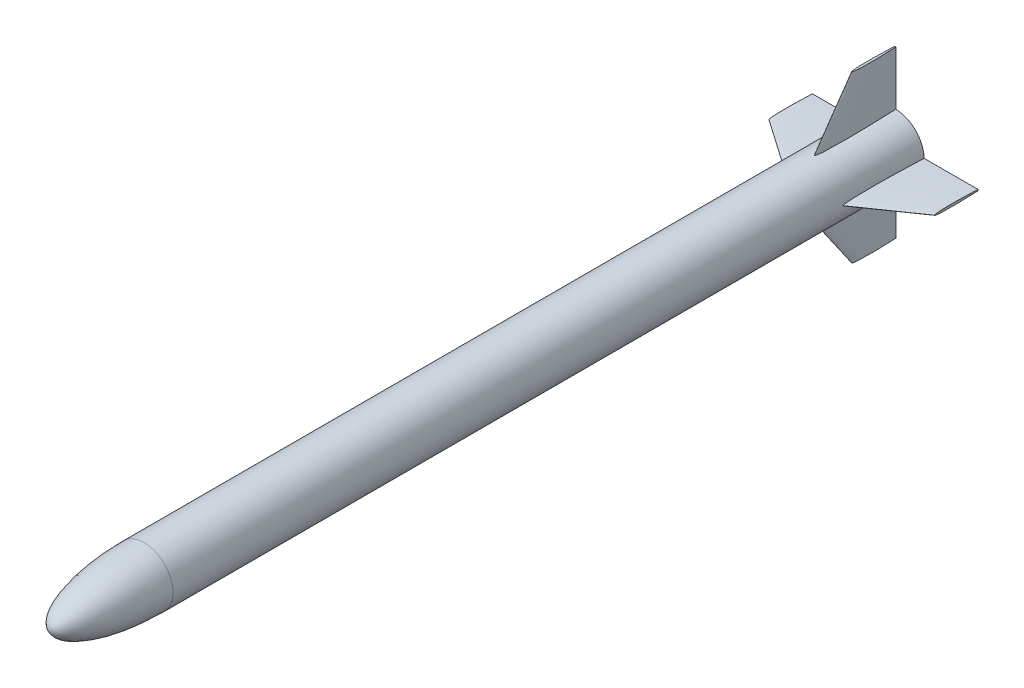
from build123d import *

# Parameters (mm, degrees)
SKETCH3_R                = 43.942
BOSS_EXTRUDE1_DEPTH      = 15.24
BOSS_EXTRUDE2_REACH      = 2331.885
BOSS_EXTRUDE2_END_RADIUS = 78.322932
SKETCH4_W                = 3.175
SKETCH4_H                = 203.2
CUT_EXTRUDE1_REACH       = 2322.063
SKETCH8_W                = 7.50506191
SKETCH8_H                = 49.98646483
CUT_EXTRUDE3_DEPTH       = 2331.683341407
CIRPATTERN1_COUNT        = 4


with BuildPart() as part:
    # Sketch2 → Revolve1 (revolve)
    with BuildSketch(Plane(origin=(0, 0, 0), x_dir=(0, 0, -1), z_dir=(1, 0, 0))):
        with BuildLine():
            Line((254, 78.322932), (2289.4925, 78.322932))
            Line((2289.4925, 78.322932), (2289.4925, 0))
            Line((2289.4925, 0), (0, 0))
            add(Edge.make_bspline(
                [(254, 78.322932), (0, 78.322932), (0, 0)],
                knots=[4.71238898, 4.71238898, 4.71238898, 6.283185307, 6.283185307, 6.283185307], degree=2, weights=[1, 0.707106781, 1]))
        make_face()
    revolve(axis=Axis((0, 0, -2289.4925), (0, 0, 1)))

    # Sketch3 → Boss-Extrude1 (add)
    with BuildSketch(Plane(origin=(0, 0, -2289.4925), x_dir=(-1, 0, 0), z_dir=(0, 0, -1))):
        Circle(SKETCH3_R)
    extrude(amount=BOSS_EXTRUDE1_DEPTH)

    # Boss-Extrude2: up to this cylinder (the profile starts outside it)
    boss_extrude2_end = Plane(origin=(0, 0, -2184.7175), z_dir=(0, 0, -1)) * Cylinder(BOSS_EXTRUDE2_END_RADIUS, 4821.415864, mode=Mode.PRIVATE)
    # Sketch4 → Boss-Extrude2 (add, up to the surface)
    with BuildSketch(Plane(origin=(0, 254, 0), x_dir=(1, 0, 0), z_dir=(0, 1, 0)), mode=Mode.PRIVATE) as boss_extrude2_sk1:
        with Locations((0, 2184.7175)):
            Rectangle(SKETCH4_W, SKETCH4_H)
    boss_extrude2_tool1 = extrude(boss_extrude2_sk1.sketch, amount=-BOSS_EXTRUDE2_REACH, mode=Mode.PRIVATE) - boss_extrude2_end
    boss_extrude2 = boss_extrude2_tool1.solids().sort_by_distance((0, 254, -2184.7175))[0]
    add(boss_extrude2)

    # Sketch5 → Cut-Extrude1 (cut, up to next)
    with BuildSketch(Plane.ZY.offset(1.5875), mode=Mode.PRIVATE) as cut_extrude1_sk1:
        Polygon((-2286.3175, 224.356842107), (-2184.7175, 224.356842107), (-2083.1175, 78.306842107), (-2083.1175, 254), (-2286.3175, 254), align=None)
    cut_extrude1_tool1 = extrude(cut_extrude1_sk1.sketch, amount=-CUT_EXTRUDE1_REACH, mode=Mode.PRIVATE) & part.part
    cut_extrude1 = cut_extrude1_tool1.solids().sort_by_distance((-1.5875, 204.128915, -2147.334252))[0]
    add(cut_extrude1, mode=Mode.SUBTRACT)

    # Sketch6 → Loft12 section 0
    with BuildSketch(Plane(origin=(0, 224.356842107, 0), x_dir=(1, 0, 0), z_dir=(0, 1, 0))):
        with BuildLine():
            add(Edge.make_bspline(
                [(0, 2171.7), (0.051023025, 2171.700648282), (0.123073762, 2171.713903143), (0.20868098, 2171.754165542), (0.306157837, 2171.828428146), (0.38077584, 2171.901401687), (0.459239223, 2171.995621491), (0.552747398, 2172.131901904), (0.67112201, 2172.341534489), (0.836676052, 2172.705674314), (1.091383201, 2173.433960229), (1.386540708, 2174.608089462), (1.683612322, 2176.186719151), (2.047714994, 2178.689894638), (2.395674972, 2181.901770917), (2.843561273, 2187.452013643), (3.233815395, 2195.347274659), (3.484465724, 2204.973743405), (3.565733066, 2216.324694259), (3.497304061, 2227.678560982), (3.316930215, 2239.026317509), (3.050599853, 2250.380330588), (2.758835231, 2260.300803769), (2.473165566, 2268.822634779), (2.164545402, 2277.309451419), (1.884603368, 2284.442277183), (1.592982913, 2291.455089252), (1.272905783, 2298.655354604), (1.021298601, 2304.13369712), (0.728615668, 2310.150742323), (0.476201594, 2315.218638113), (0.210201711, 2320.23896901), (0.070930363, 2322.811698128), (0, 2324.100018296)],
                knots=[0, 0, 0, 0, 0, 0.001188773, 0.001744604, 0.002211261, 0.002902454, 0.003665217, 0.004655039, 0.006134761, 0.008618592, 0.013161868, 0.022971681, 0.034880856, 0.046790031, 0.073273565, 0.0997571, 0.167217454, 0.23467781, 0.302138166, 0.369598523, 0.437058879, 0.504519235, 0.571979591, 0.60570977, 0.639439948, 0.706900304, 0.740630482, 0.77436066, 0.808090839, 0.841821017, 0.875551195, 0.909281373, 0.909281373, 0.909281373, 0.909281373, 0.909281373], degree=4))
            add(Edge.make_bspline(
                [(0, 2171.7), (-0.051023025, 2171.700648282), (-0.123073762, 2171.713903143), (-0.20868098, 2171.754165542), (-0.306157837, 2171.828428146), (-0.38077584, 2171.901401687), (-0.459239223, 2171.995621491), (-0.552747398, 2172.131901904), (-0.67112201, 2172.341534489), (-0.836676052, 2172.705674314), (-1.091383201, 2173.433960229), (-1.386540708, 2174.608089462), (-1.683612322, 2176.186719151), (-2.047714994, 2178.689894638), (-2.395674972, 2181.901770917), (-2.843561273, 2187.452013643), (-3.233815395, 2195.347274659), (-3.484465724, 2204.973743405), (-3.565733066, 2216.324694259), (-3.497304061, 2227.678560982), (-3.316930215, 2239.026317509), (-3.050599853, 2250.380330588), (-2.758835231, 2260.300803769), (-2.473165566, 2268.822634779), (-2.164545402, 2277.309451419), (-1.884603368, 2284.442277183), (-1.592982913, 2291.455089252), (-1.272905783, 2298.655354604), (-1.021298601, 2304.13369712), (-0.728615668, 2310.150742323), (-0.476201594, 2315.218638113), (-0.210201711, 2320.238969009), (-0.070930363, 2322.811698128), (0, 2324.100018296)],
                knots=[0, 0, 0, 0, 0, 0.001188773, 0.001744604, 0.002211261, 0.002902454, 0.003665217, 0.004655039, 0.006134761, 0.008618592, 0.013161868, 0.022971681, 0.034880856, 0.046790031, 0.073273565, 0.0997571, 0.167217454, 0.23467781, 0.302138166, 0.369598523, 0.437058879, 0.504519235, 0.571979591, 0.60570977, 0.639439948, 0.706900304, 0.740630482, 0.77436066, 0.808090839, 0.841821017, 0.875551195, 0.909281373, 0.909281373, 0.909281373, 0.909281373, 0.909281373], degree=4))
        make_face()
    # Sketch7 → Loft12 section 1
    with BuildSketch(Plane(origin=(0, 78.232, 0), x_dir=(1, 0, 0), z_dir=(0, 1, 0))):
        with BuildLine():
            add(Edge.make_bspline(
                [(0, 2070.1), (0.034219924, 2070.100165249), (0.101433103, 2070.107349373), (0.231578713, 2070.150196993), (0.360328489, 2070.246951985), (0.462507028, 2070.353564142), (0.561959786, 2070.481012431), (0.644614931, 2070.603175552), (0.750526321, 2070.78519167), (0.892167773, 2071.074452021), (1.083903907, 2071.549787837), (1.369429879, 2072.438060657), (1.816145557, 2074.293717739), (2.298808701, 2077.180168637), (2.769987399, 2080.990528328), (3.296814895, 2086.604968322), (3.769686564, 2093.440016864), (4.283475655, 2103.673053012), (4.695953859, 2117.307852477), (4.924993808, 2133.219867535), (4.949672088, 2151.407398455), (4.801833129, 2169.593016337), (4.556982302, 2185.505734367), (4.283038202, 2199.141404202), (3.964939404, 2212.780562475), (3.667273138, 2224.137774842), (3.340204516, 2235.509585415), (2.988306879, 2246.856607416), (2.690431026, 2255.967845223), (2.303497954, 2267.285895323), (1.805042261, 2280.999071732), (1.282003917, 2294.482999268), (0.752405736, 2307.183955871), (0.368402997, 2315.97815155), (0.142501679, 2320.98629114), (0.04750229, 2323.067612156), (0, 2324.100021297)],
                knots=[0, 0, 0, 0, 0, 0.000482574, 0.000965149, 0.001930298, 0.002260301, 0.002590304, 0.003269978, 0.004035031, 0.005264177, 0.007184719, 0.010581715, 0.017344383, 0.032491444, 0.048939298, 0.065387151, 0.097842867, 0.130298584, 0.19521002, 0.260121457, 0.325032894, 0.389944331, 0.454855768, 0.487311487, 0.519767205, 0.584678642, 0.617134361, 0.649590079, 0.682045798, 0.714501516, 0.779412953, 0.84432439, 0.876780109, 0.893007968, 0.909235827, 0.909235827, 0.909235827, 0.909235827, 0.909235827], degree=4))
            add(Edge.make_bspline(
                [(0, 2070.1), (-0.034219924, 2070.100165249), (-0.101433103, 2070.107349373), (-0.231578713, 2070.150196993), (-0.360328489, 2070.246951985), (-0.462507028, 2070.353564142), (-0.561959786, 2070.481012431), (-0.644614931, 2070.603175552), (-0.750526321, 2070.78519167), (-0.892167773, 2071.074452021), (-1.083903907, 2071.549787837), (-1.369429879, 2072.438060657), (-1.816145557, 2074.293717739), (-2.298808701, 2077.180168637), (-2.769987399, 2080.990528328), (-3.296814895, 2086.604968322), (-3.769686564, 2093.440016864), (-4.283475655, 2103.673053012), (-4.695953859, 2117.307852477), (-4.924993808, 2133.219867535), (-4.949672088, 2151.407398455), (-4.801833129, 2169.593016337), (-4.556982302, 2185.505734367), (-4.283038202, 2199.141404202), (-3.964939404, 2212.780562475), (-3.667273138, 2224.137774842), (-3.340204516, 2235.509585415), (-2.988306879, 2246.856607416), (-2.690431026, 2255.967845223), (-2.303497954, 2267.285895323), (-1.805042261, 2280.999071732), (-1.282003917, 2294.482999268), (-0.752405736, 2307.183955871), (-0.368402997, 2315.97815155), (-0.142501679, 2320.98629114), (-0.04750229, 2323.067612156), (0, 2324.100021297)],
                knots=[0, 0, 0, 0, 0, 0.000482574, 0.000965149, 0.001930298, 0.002260301, 0.002590304, 0.003269978, 0.004035031, 0.005264177, 0.007184719, 0.010581715, 0.017344383, 0.032491444, 0.048939298, 0.065387151, 0.097842867, 0.130298584, 0.19521002, 0.260121457, 0.325032894, 0.389944331, 0.454855768, 0.487311487, 0.519767205, 0.584678642, 0.617134361, 0.649590079, 0.682045798, 0.714501516, 0.779412953, 0.84432439, 0.876780109, 0.893007968, 0.909235827, 0.909235827, 0.909235827, 0.909235827, 0.909235827], degree=4))
        make_face()
    loft12 = loft()

    # Sketch8 → Cut-Extrude3 (cut, through all)
    with BuildSketch(Plane.XZ.offset(-78.232)):
        with Locations((-1.209951309, -2314.485732415)):
            Rectangle(SKETCH8_W, SKETCH8_H)
    cut_extrude3 = extrude(amount=-CUT_EXTRUDE3_DEPTH, mode=Mode.SUBTRACT)

    # CirPattern1: Boss-Extrude2, Cut-Extrude1, Loft12, Cut-Extrude3 ×4 about axis
    cirpattern1_axis = Axis((0, 0, -2289.4925), (0, 0, -1))
    add([boss_extrude2.rotate(cirpattern1_axis, i * 360 / CIRPATTERN1_COUNT) for i in range(1, CIRPATTERN1_COUNT)])
    add([cut_extrude1.rotate(cirpattern1_axis, i * 360 / CIRPATTERN1_COUNT) for i in range(1, CIRPATTERN1_COUNT)], mode=Mode.SUBTRACT)
    add([loft12.rotate(cirpattern1_axis, i * 360 / CIRPATTERN1_COUNT) for i in range(1, CIRPATTERN1_COUNT)])
    add([cut_extrude3.rotate(cirpattern1_axis, i * 360 / CIRPATTERN1_COUNT) for i in range(1, CIRPATTERN1_COUNT)], mode=Mode.SUBTRACT)


solid = part.part
